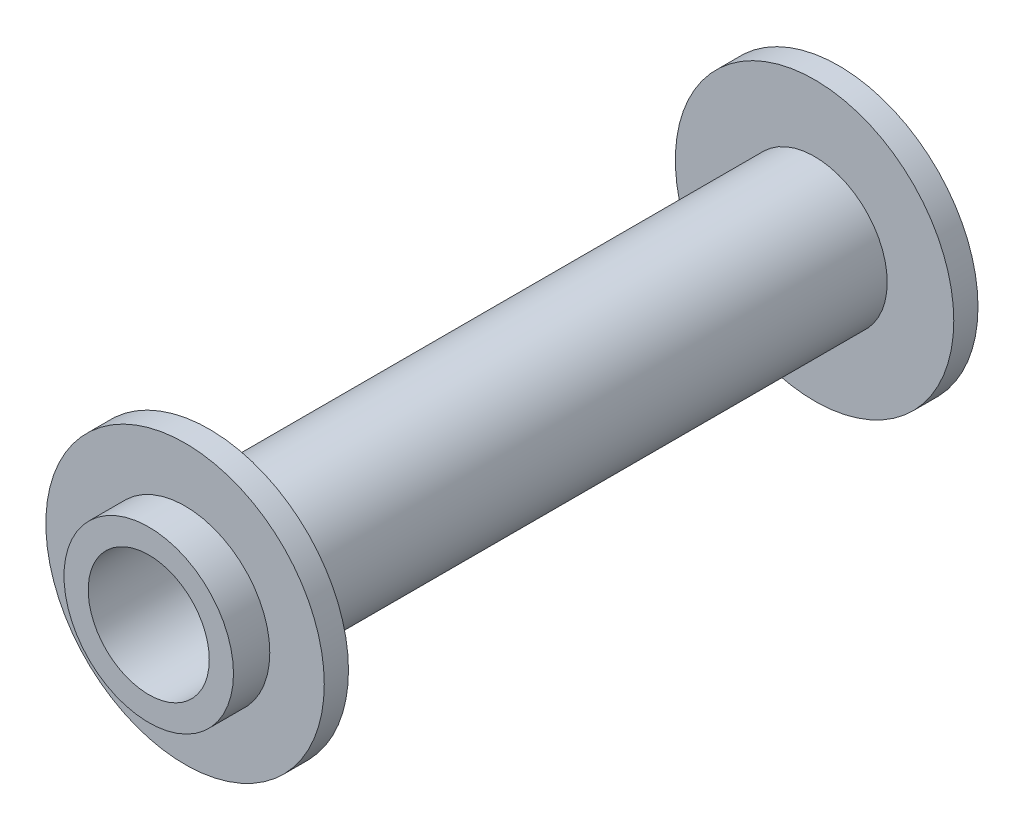
from build123d import *


with BuildPart() as part:
    # Sketch2 → Revolve1 (revolve)
    with BuildSketch(Plane(origin=(0, 0, 0), x_dir=(0, 0, -1), z_dir=(1, 0, 0))):
        Polygon((0, 5), (0, 7), (3, 7), (3, 11.5), (5, 11.5), (5, 6), (55, 6), (55, 11.5), (57, 11.5), (57, 7), (60, 7), (60, 5), align=None)
    revolve(axis=Axis((0, 0, 0), (0, 0, -1)))


solid = part.part
